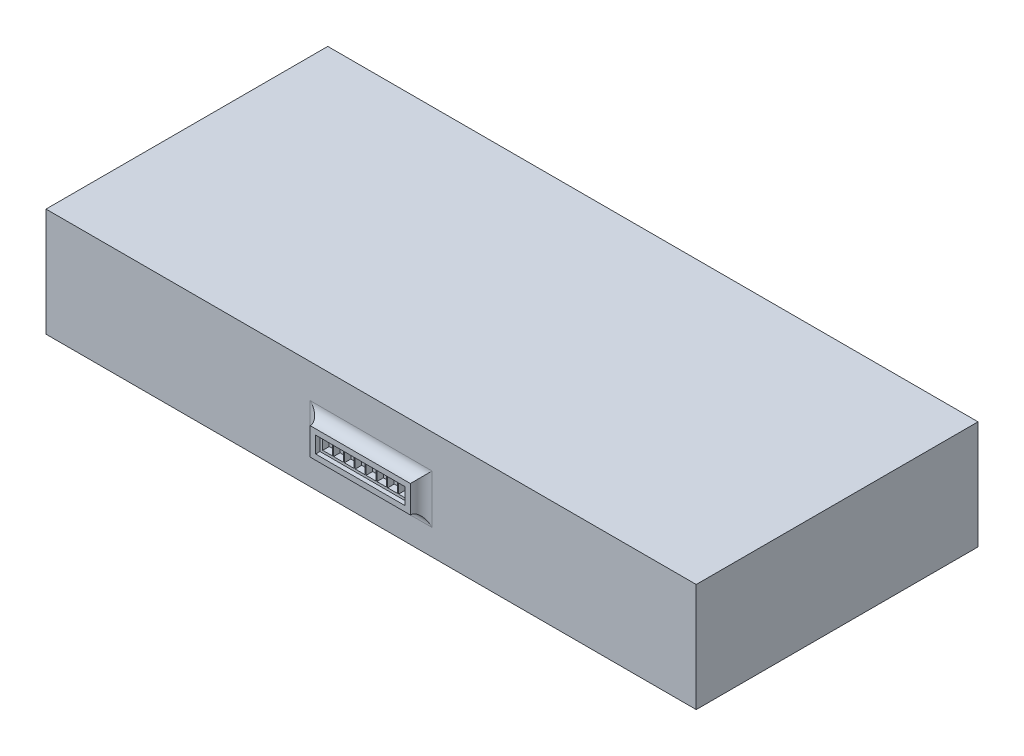
from build123d import *

# Parameters (mm, degrees)
SKETCH1_W           = 600
SKETCH1_H           = 260
BOSS_EXTRUDE1_DEPTH = 100
SHELL1_T            = 2
SKETCH2_W           = 92.440689116
SKETCH2_H           = 25.153929011
SKETCH2_W_2         = 82.440689116
SKETCH2_H_2         = 15.153929011
BOSS_EXTRUDE2_DEPTH = 10
SKETCH2_3_W         = 82.440689116
SKETCH2_3_H         = 15.153929011
SKETCH2_3_W_2       = 9.01524931
SKETCH2_3_H_2       = 10.647439476
BOSS_EXTRUDE3_DEPTH = 6
FILLET1_R           = 10


with BuildPart() as part:
    # Sketch1 → Boss-Extrude1 (new body)
    with BuildSketch(Plane(origin=(0, 0, 0), x_dir=(1, 0, 0), z_dir=(0, 1, 0))):
        Rectangle(SKETCH1_W, SKETCH1_H)
    extrude(amount=BOSS_EXTRUDE1_DEPTH)

    # Shell1 (no face opened: a closed hollow body)
    add(offset(amount=-SHELL1_T, mode=Mode.PRIVATE), mode=Mode.SUBTRACT)

    # Sketch2 → Boss-Extrude2 (add)
    with BuildSketch(Plane.XY.offset(130)):
        with Locations((0, 46.226910649)):
            Rectangle(SKETCH2_W, SKETCH2_H)
        with Locations((0, 46.226910649)):
            Rectangle(SKETCH2_W_2, SKETCH2_H_2, mode=Mode.SUBTRACT)
    extrude(amount=BOSS_EXTRUDE2_DEPTH)

    # Sketch2<3> → Boss-Extrude3 (add)
    with BuildSketch(Plane.XY.offset(130)):
        with Locations((0, 46.226910649)):
            Rectangle(SKETCH2_3_W, SKETCH2_3_H)
        with Locations((35.85201026, 46.226910648)):
            Rectangle(SKETCH2_3_W_2, SKETCH2_3_H_2, mode=Mode.SUBTRACT)
        with Locations((25.85201026, 46.226910648)):
            Rectangle(SKETCH2_3_W_2, SKETCH2_3_H_2, mode=Mode.SUBTRACT)
        with Locations((15.85201026, 46.226910648)):
            Rectangle(SKETCH2_3_W_2, SKETCH2_3_H_2, mode=Mode.SUBTRACT)
        with Locations((5.85201026, 46.226910648)):
            Rectangle(SKETCH2_3_W_2, SKETCH2_3_H_2, mode=Mode.SUBTRACT)
        with Locations((-4.14798974, 46.226910648)):
            Rectangle(SKETCH2_3_W_2, SKETCH2_3_H_2, mode=Mode.SUBTRACT)
        with Locations((-14.14798974, 46.226910648)):
            Rectangle(SKETCH2_3_W_2, SKETCH2_3_H_2, mode=Mode.SUBTRACT)
        with Locations((-24.14798974, 46.226910648)):
            Rectangle(SKETCH2_3_W_2, SKETCH2_3_H_2, mode=Mode.SUBTRACT)
        with Locations((-34.14798974, 46.226910648)):
            Rectangle(SKETCH2_3_W_2, SKETCH2_3_H_2, mode=Mode.SUBTRACT)
    extrude(amount=BOSS_EXTRUDE3_DEPTH)

    # Fillet1
    fillet1_edges = [part.edges().sort_by_distance(p)[0] for p in [
        (46.220344558, 46.226910648, 130),
        (0, 58.803875154, 130),
        (-46.220344558, 46.226910648, 130),
        (0, 33.649946143, 130),
    ]]
    fillet(fillet1_edges, radius=FILLET1_R - 0.0001)  # a hair under: the kernel refuses the full size


solid = part.part
